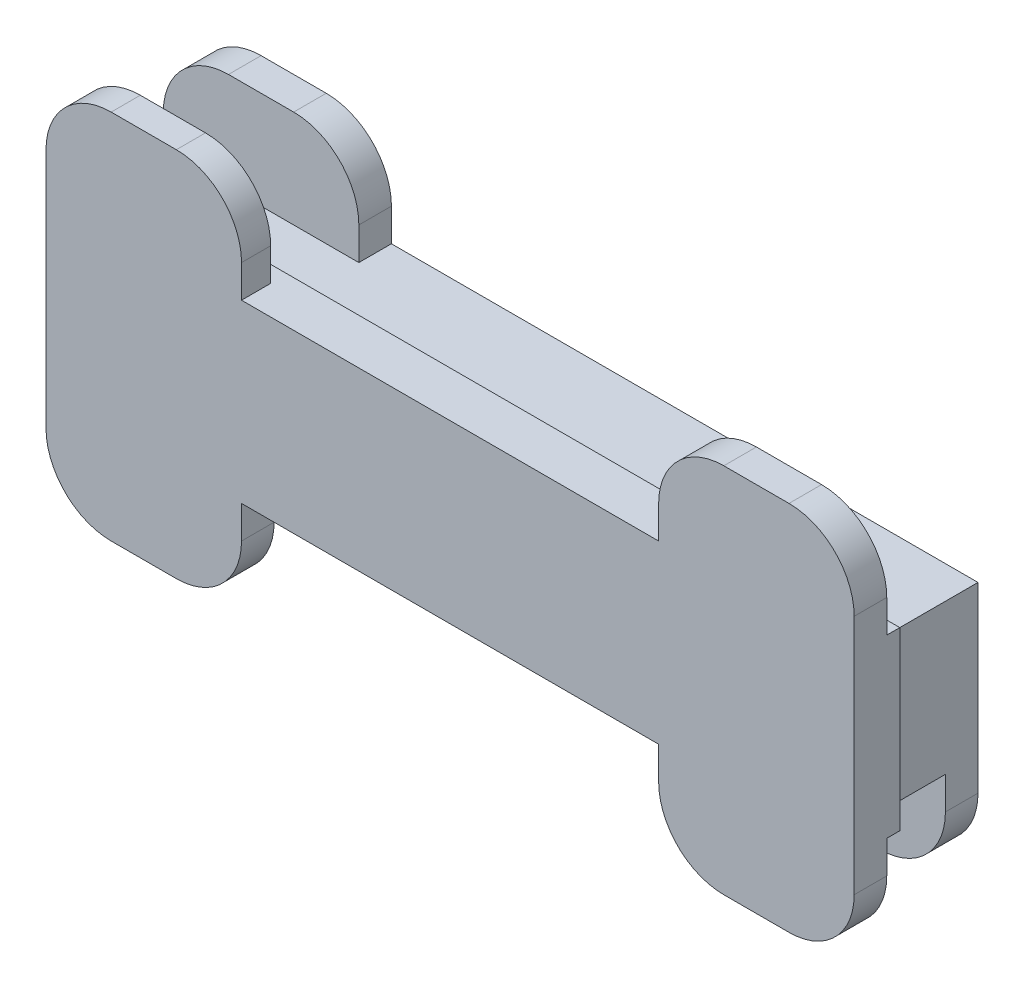
from build123d import *

# Parameters (mm, degrees)
EXTRUDE_1_OUTLINE_W         = 15
EXTRUDE_1_OUTLINE_H         = 15
EXTRUDE_1_DEPTH             = 8
SKETCH_2_W                  = 6
SKETCH_2_H                  = 11
CUT_EXTRUDE_1_DEPTH         = 13
SKETCH_3_W                  = 3
SKETCH_3_H                  = 15
EXTRUDE_2_DEPTH             = 2
PATTERN_LINEAR_2_COUNT      = 11
PATTERN_LINEAR_2_PITCH      = 10
SKETCH_5_W                  = 12
SKETCH_5_H                  = 15
EXTRUDE_3_DEPTH             = 2
SKETCH_6_W                  = 15
SKETCH_6_H                  = 15
EXTRUDE_4_DEPTH             = 2
SKETCH_7_W                  = 94
SKETCH_7_H                  = 2
CUT_EXTRUDE_2_DEPTH         = 2
SKETCH_9_W                  = 108
SKETCH_9_H                  = 13
SKETCH_9_W_2                = 106
SKETCH_9_H_2                = 11
EXTRUDE_5_DEPTH             = 2
SKETCH_10_W                 = 2
SKETCH_10_H                 = 2.5
EXTRUDE_6_DEPTH             = 2
PATTERN_LINEAR_3_COUNT      = 10
PATTERN_LINEAR_3_PITCH      = 10
SKETCH_11_W                 = 120
SKETCH_11_H                 = 23
EXTRUDE_7_DEPTH             = 21
SPLIT_START                 = 2
SPLIT_BODIES_2_DEPTH        = 11
SPLIT_START_2               = -4
SPLIT_BODIES_2_2_DEPTH      = 23
SPLIT_BODIES_2_3_OUTLINE_W  = 108
SPLIT_BODIES_2_3_OUTLINE_H  = 2
SPLIT_BODIES_2_3_DEPTH      = 5
SPLIT_START_3               = 14
SPLIT_BODIES_2_4_OUTLINE_W  = 108
SPLIT_BODIES_2_4_OUTLINE_H  = 2
SPLIT_BODIES_2_4_DEPTH      = 5
SPLIT_START_4               = 6.5
SPLIT_BODIES_2_5_DEPTH      = 2
SPLIT_START_5               = 5.5
SPLIT_BODIES_2_6_OUTLINE_W  = 2
SPLIT_BODIES_2_6_OUTLINE_H  = 2
SPLIT_BODIES_2_6_DEPTH      = 4
SPLIT_BODIES_2_7_OUTLINE_W  = 2
SPLIT_BODIES_2_7_OUTLINE_H  = 2
SPLIT_BODIES_2_7_DEPTH      = 1
SPLIT_START_6               = 12
SPLIT_BODIES_2_8_OUTLINE_W  = 2
SPLIT_BODIES_2_8_OUTLINE_H  = 2
SPLIT_BODIES_2_8_DEPTH      = 1
SPLIT_BODIES_2_9_OUTLINE_W  = 120
SPLIT_BODIES_2_9_OUTLINE_H  = 23
SPLIT_BODIES_2_9_DEPTH      = 6
SPLIT_START_7               = -13
SPLIT_BODIES_2_10_OUTLINE_W = 6
SPLIT_BODIES_2_10_OUTLINE_H = 11
SPLIT_BODIES_2_10_DEPTH     = 13
SPLIT_START_8               = -2
SPLIT_BODIES_2_11_OUTLINE_W = 4
SPLIT_BODIES_2_11_OUTLINE_H = 2
SPLIT_BODIES_2_11_DEPTH     = 2
SKETCH_12_W                 = 30
SKETCH_12_H                 = 5
EXTRUDE_8_DEPTH             = 15
SKETCH_13_W                 = 30
SKETCH_13_H                 = 5
EXTRUDE_9_DEPTH             = 15
FILLET_4_R                  = 10
FILLET_5_R                  = 10
FILLET_6_R                  = 10
FILLET_7_R                  = 10
SKETCH_14_W                 = 124
SKETCH_14_H                 = 27
SKETCH_14_W_2               = 120
SKETCH_14_H_2               = 23
EXTRUDE_10_DEPTH            = 7
SKETCH_16_W                 = 30
SKETCH_16_H                 = 5
EXTRUDE_12_DEPTH            = 15
SKETCH_18_W                 = 30
SKETCH_18_H                 = 4.472657844
SKETCH_18_H_2               = 5
EXTRUDE_13_DEPTH            = 15
FILLET_8_R                  = 10
FILLET_9_R                  = 10
FILLET_10_R                 = 10
FILLET_11_R                 = 10
FILLET_12_R                 = 10
FILLET_13_R                 = 10
FILLET_14_R                 = 10
FILLET_15_R                 = 10


# Read off the part's stored shape, not the designer's step: 凸台-拉伸1, 分割2
with BuildPart() as part:
    # 凸台-拉伸1 outline → 凸台-拉伸1 (new body)
    with BuildSketch(Plane.YZ):
        with Locations((7.5, -7.5)):
            Rectangle(EXTRUDE_1_OUTLINE_W, EXTRUDE_1_OUTLINE_H)
    extrude(amount=EXTRUDE_1_DEPTH)

    # 草图2 → 切除-拉伸1 (cut)
    with BuildSketch(Plane.XY):
        with Locations((4, 7.5)):
            Rectangle(SKETCH_2_W, SKETCH_2_H)
    extrude(amount=-CUT_EXTRUDE_1_DEPTH, mode=Mode.SUBTRACT)

    # 草图3 → 凸台-拉伸2 (add)
    with BuildSketch(Plane(origin=(8, 0, 0), x_dir=(0, 0, -1), z_dir=(1, 0, 0))):
        with Locations((1.5, 7.5)):
            Rectangle(SKETCH_3_W, SKETCH_3_H)
    extrude(amount=EXTRUDE_2_DEPTH)


with BuildPart() as pattern_linear_2_1:
    # 阵列(线性)2: pattern copy
    add(part.part.moved(Location(Vector(1, 0, 0) * (1 * PATTERN_LINEAR_2_PITCH))))


with BuildPart() as pattern_linear_2_2:
    # 阵列(线性)2: pattern copy
    add(part.part.moved(Location(Vector(1, 0, 0) * (2 * PATTERN_LINEAR_2_PITCH))))


with BuildPart() as pattern_linear_2_3:
    # 阵列(线性)2: pattern copy
    add(part.part.moved(Location(Vector(1, 0, 0) * (3 * PATTERN_LINEAR_2_PITCH))))


with BuildPart() as pattern_linear_2_4:
    # 阵列(线性)2: pattern copy
    add(part.part.moved(Location(Vector(1, 0, 0) * (4 * PATTERN_LINEAR_2_PITCH))))


with BuildPart() as pattern_linear_2_5:
    # 阵列(线性)2: pattern copy
    add(part.part.moved(Location(Vector(1, 0, 0) * (5 * PATTERN_LINEAR_2_PITCH))))


with BuildPart() as pattern_linear_2_6:
    # 阵列(线性)2: pattern copy
    add(part.part.moved(Location(Vector(1, 0, 0) * (6 * PATTERN_LINEAR_2_PITCH))))


with BuildPart() as pattern_linear_2_7:
    # 阵列(线性)2: pattern copy
    add(part.part.moved(Location(Vector(1, 0, 0) * (7 * PATTERN_LINEAR_2_PITCH))))


with BuildPart() as pattern_linear_2_8:
    # 阵列(线性)2: pattern copy
    add(part.part.moved(Location(Vector(1, 0, 0) * (8 * PATTERN_LINEAR_2_PITCH))))


with BuildPart() as pattern_linear_2_9:
    # 阵列(线性)2: pattern copy
    add(part.part.moved(Location(Vector(1, 0, 0) * (9 * PATTERN_LINEAR_2_PITCH))))


with BuildPart() as pattern_linear_2_10:
    # 阵列(线性)2: pattern copy
    add(part.part.moved(Location(Vector(1, 0, 0) * (10 * PATTERN_LINEAR_2_PITCH))))


with BuildPart() as part_1:
    add(part.part)

    # Combine 2: union 阵列(线性)2_1, 阵列(线性)2_2, 阵列(线性)2_3, 阵列(线性)2_4, 阵列(线性)2_5, 阵列(线性)2_6, 阵列(线性)2_7, 阵列(线性)2_8, 阵列(线性)2_9, 阵列(线性)2_10
    add(pattern_linear_2_1.part)
    add(pattern_linear_2_2.part)
    add(pattern_linear_2_3.part)
    add(pattern_linear_2_4.part)
    add(pattern_linear_2_5.part)
    add(pattern_linear_2_6.part)
    add(pattern_linear_2_7.part)
    add(pattern_linear_2_8.part)
    add(pattern_linear_2_9.part)
    add(pattern_linear_2_10.part)

    # 草图5 → 凸台-拉伸3 (add)
    with BuildSketch(Plane(origin=(108, 0, 0), x_dir=(0, 0, -1), z_dir=(1, 0, 0))):
        with Locations((9, 7.5)):
            Rectangle(SKETCH_5_W, SKETCH_5_H)
    extrude(amount=EXTRUDE_3_DEPTH)

    # 草图6 → 凸台-拉伸4 (add)
    with BuildSketch(Plane.ZY):
        with Locations((-7.5, 7.5)):
            Rectangle(SKETCH_6_W, SKETCH_6_H)
    extrude(amount=EXTRUDE_4_DEPTH)

    # 草图7 → 切除-拉伸2 (cut)
    with BuildSketch(Plane.XY):
        with Locations((54, 7.5)):
            Rectangle(SKETCH_7_W, SKETCH_7_H)
    extrude(amount=-CUT_EXTRUDE_2_DEPTH, mode=Mode.SUBTRACT)

    # 草图9 → 凸台-拉伸5 (add)
    with BuildSketch(Plane.XY):
        with Locations((54, 7.5)):
            Rectangle(SKETCH_9_W, SKETCH_9_H)
        with Locations((54, 7.5)):
            Rectangle(SKETCH_9_W_2, SKETCH_9_H_2, mode=Mode.SUBTRACT)
    extrude(amount=EXTRUDE_5_DEPTH)

    # 草图10 → 凸台-拉伸6 (add)
    with BuildSketch(Plane.XY):
        with Locations((9, 4.25)):
            Rectangle(SKETCH_10_W, SKETCH_10_H)
        with Locations((9, 10.75)):
            Rectangle(SKETCH_10_W, SKETCH_10_H)
    extrude_6 = extrude(amount=EXTRUDE_6_DEPTH)

    # 阵列(线性)3: 凸台-拉伸6 ×10
    with Locations(*[(i * PATTERN_LINEAR_3_PITCH, 0, 0) for i in range(1, PATTERN_LINEAR_3_COUNT)]):
        add(extrude_6)


with BuildPart() as body_2:
    # 草图11 → 凸台-拉伸7 (new body)
    with BuildSketch(Plane(origin=(0, 0, -15), x_dir=(-1, 0, 0), z_dir=(0, 0, -1))):
        with Locations((-54, 7.5)):
            Rectangle(SKETCH_11_W, SKETCH_11_H)
    extrude(amount=-EXTRUDE_7_DEPTH)

    # Combine 3: cut part
    add(part_1.part, mode=Mode.SUBTRACT)

    # Split Bodies 2 9 outline → Split Bodies 2 9 (cut)
    with BuildSketch(Plane.XY):
        with Locations((54, 7.5)):
            Rectangle(SPLIT_BODIES_2_9_OUTLINE_W, SPLIT_BODIES_2_9_OUTLINE_H)
    extrude(amount=SPLIT_BODIES_2_9_DEPTH, mode=Mode.SUBTRACT)

    # Split Bodies 2 10 outline → Split Bodies 2 10 (cut)
    with BuildSketch(Plane.XY.offset(SPLIT_START_7)):
        with Locations((4, 7.5)):
            Rectangle(SPLIT_BODIES_2_10_OUTLINE_W, SPLIT_BODIES_2_10_OUTLINE_H)
        with Locations((14, 7.5)):
            Rectangle(SPLIT_BODIES_2_10_OUTLINE_W, SPLIT_BODIES_2_10_OUTLINE_H)
        with Locations((24, 7.5)):
            Rectangle(SPLIT_BODIES_2_10_OUTLINE_W, SPLIT_BODIES_2_10_OUTLINE_H)
        with Locations((34, 7.5)):
            Rectangle(SPLIT_BODIES_2_10_OUTLINE_W, SPLIT_BODIES_2_10_OUTLINE_H)
        with Locations((44, 7.5)):
            Rectangle(SPLIT_BODIES_2_10_OUTLINE_W, SPLIT_BODIES_2_10_OUTLINE_H)
        with Locations((54, 7.5)):
            Rectangle(SPLIT_BODIES_2_10_OUTLINE_W, SPLIT_BODIES_2_10_OUTLINE_H)
        with Locations((64, 7.5)):
            Rectangle(SPLIT_BODIES_2_10_OUTLINE_W, SPLIT_BODIES_2_10_OUTLINE_H)
        with Locations((74, 7.5)):
            Rectangle(SPLIT_BODIES_2_10_OUTLINE_W, SPLIT_BODIES_2_10_OUTLINE_H)
        with Locations((84, 7.5)):
            Rectangle(SPLIT_BODIES_2_10_OUTLINE_W, SPLIT_BODIES_2_10_OUTLINE_H)
        with Locations((94, 7.5)):
            Rectangle(SPLIT_BODIES_2_10_OUTLINE_W, SPLIT_BODIES_2_10_OUTLINE_H)
        with Locations((104, 7.5)):
            Rectangle(SPLIT_BODIES_2_10_OUTLINE_W, SPLIT_BODIES_2_10_OUTLINE_H)
    extrude(amount=SPLIT_BODIES_2_10_DEPTH, mode=Mode.SUBTRACT)

    # Split Bodies 2 11 outline → Split Bodies 2 11 (cut)
    with BuildSketch(Plane.XY.offset(SPLIT_START_8)):
        with Locations((9, 7.5)):
            Rectangle(SPLIT_BODIES_2_11_OUTLINE_W, SPLIT_BODIES_2_11_OUTLINE_H)
        with Locations((19, 7.5)):
            Rectangle(SPLIT_BODIES_2_11_OUTLINE_W, SPLIT_BODIES_2_11_OUTLINE_H)
        with Locations((29, 7.5)):
            Rectangle(SPLIT_BODIES_2_11_OUTLINE_W, SPLIT_BODIES_2_11_OUTLINE_H)
        with Locations((39, 7.5)):
            Rectangle(SPLIT_BODIES_2_11_OUTLINE_W, SPLIT_BODIES_2_11_OUTLINE_H)
        with Locations((49, 7.5)):
            Rectangle(SPLIT_BODIES_2_11_OUTLINE_W, SPLIT_BODIES_2_11_OUTLINE_H)
        with Locations((59, 7.5)):
            Rectangle(SPLIT_BODIES_2_11_OUTLINE_W, SPLIT_BODIES_2_11_OUTLINE_H)
        with Locations((69, 7.5)):
            Rectangle(SPLIT_BODIES_2_11_OUTLINE_W, SPLIT_BODIES_2_11_OUTLINE_H)
        with Locations((79, 7.5)):
            Rectangle(SPLIT_BODIES_2_11_OUTLINE_W, SPLIT_BODIES_2_11_OUTLINE_H)
        with Locations((89, 7.5)):
            Rectangle(SPLIT_BODIES_2_11_OUTLINE_W, SPLIT_BODIES_2_11_OUTLINE_H)
        with Locations((99, 7.5)):
            Rectangle(SPLIT_BODIES_2_11_OUTLINE_W, SPLIT_BODIES_2_11_OUTLINE_H)
    extrude(amount=SPLIT_BODIES_2_11_DEPTH, mode=Mode.SUBTRACT)

    # 草图12 → 凸台-拉伸8 (add)
    with BuildSketch(Plane(origin=(0, 19, 0), x_dir=(1, 0, 0), z_dir=(0, 1, 0))):
        with Locations((9, 12.5)):
            Rectangle(SKETCH_12_W, SKETCH_12_H)
    extrude(amount=EXTRUDE_8_DEPTH)

    # 草图13 → 凸台-拉伸9 (add)
    with BuildSketch(Plane.XZ.offset(4)):
        with Locations((99, -12.5)):
            Rectangle(SKETCH_13_W, SKETCH_13_H)
    extrude(amount=EXTRUDE_9_DEPTH)

    # 圆角4
    fillet_4_edges = [body_2.edges().sort_by_distance(p)[0] for p in [
        (84, -19, -12.5),
    ]]
    fillet(fillet_4_edges, radius=FILLET_4_R)

    # 圆角5
    fillet_5_edges = [body_2.edges().sort_by_distance(p)[0] for p in [
        (114, -19, -12.5),
    ]]
    fillet(fillet_5_edges, radius=FILLET_5_R)

    # 圆角6
    fillet_6_edges = [body_2.edges().sort_by_distance(p)[0] for p in [
        (-6, 34, -12.5),
    ]]
    fillet(fillet_6_edges, radius=FILLET_6_R)

    # 圆角7
    fillet_7_edges = [body_2.edges().sort_by_distance(p)[0] for p in [
        (24, 34, -12.5),
    ]]
    fillet(fillet_7_edges, radius=FILLET_7_R)


with BuildPart() as body_2_2:
    # Split Bodies 2 outline → Split Bodies 2 (new body)
    with BuildSketch(Plane(origin=(0, 0, 0), x_dir=(1, 0, 0), z_dir=(0, 1, 0)).offset(SPLIT_START)):
        Polygon((97, 0), (97, 13), (91, 13), (91, 0), (90, 0), (90, -2), (88, -2), (88, 0), (87, 0), (87, 13), (81, 13), (81, 0), (80, 0), (80, -2), (78, -2), (78, 0), (77, 0), (77, 13), (71, 13), (71, 0), (70, 0), (70, -2), (68, -2), (68, 0), (67, 0), (67, 13), (61, 13), (61, 0), (60, 0), (60, -2), (58, -2), (58, 0), (57, 0), (57, 13), (51, 13), (51, 0), (50, 0), (50, -2), (48, -2), (48, 0), (47, 0), (47, 13), (41, 13), (41, 0), (40, 0), (40, -2), (38, -2), (38, 0), (37, 0), (37, 13), (31, 13), (31, 0), (30, 0), (30, -2), (28, -2), (28, 0), (27, 0), (27, 13), (21, 13), (21, 0), (20, 0), (20, -2), (18, -2), (18, 0), (17, 0), (17, 13), (11, 13), (11, 0), (10, 0), (10, -2), (8, -2), (8, 0), (7, 0), (7, 13), (1, 13), (1, -2), (0, -2), (0, 0), (-6, 0), (-6, -6), (114, -6), (114, 0), (108, 0), (108, -2), (107, -2), (107, 13), (101, 13), (101, 0), (100, 0), (100, -2), (98, -2), (98, 0), align=None)
    extrude(amount=SPLIT_BODIES_2_DEPTH)

    # Split Bodies 2 2 outline → Split Bodies 2 2 (add)
    with BuildSketch(Plane(origin=(0, 0, 0), x_dir=(1, 0, 0), z_dir=(0, 1, 0)).offset(SPLIT_START_2)):
        Polygon((108, -2), (0, -2), (0, 0), (-6, 0), (-6, -6), (114, -6), (114, 0), (108, 0), align=None)
    extrude(amount=SPLIT_BODIES_2_2_DEPTH)

    # Split Bodies 2 3 outline → Split Bodies 2 3 (add)
    with BuildSketch(Plane(origin=(0, 0, 0), x_dir=(1, 0, 0), z_dir=(0, 1, 0)).offset(SPLIT_START_2)):
        with Locations((54, -1)):
            Rectangle(SPLIT_BODIES_2_3_OUTLINE_W, SPLIT_BODIES_2_3_OUTLINE_H)
    extrude(amount=SPLIT_BODIES_2_3_DEPTH)

    # Split Bodies 2 4 outline → Split Bodies 2 4 (add)
    with BuildSketch(Plane(origin=(0, 0, 0), x_dir=(1, 0, 0), z_dir=(0, 1, 0)).offset(SPLIT_START_3)):
        with Locations((54, -1)):
            Rectangle(SPLIT_BODIES_2_4_OUTLINE_W, SPLIT_BODIES_2_4_OUTLINE_H)
    extrude(amount=SPLIT_BODIES_2_4_DEPTH)

    # Split Bodies 2 5 outline → Split Bodies 2 5 (add)
    with BuildSketch(Plane(origin=(0, 0, 0), x_dir=(1, 0, 0), z_dir=(0, 1, 0)).offset(SPLIT_START_4)):
        Polygon((101, 2), (97, 2), (97, 0), (98, 0), (98, -2), (100, -2), (100, 0), (101, 0), align=None)
        Polygon((90, 0), (91, 0), (91, 2), (87, 2), (87, 0), (88, 0), (88, -2), (90, -2), align=None)
        Polygon((80, 0), (81, 0), (81, 2), (77, 2), (77, 0), (78, 0), (78, -2), (80, -2), align=None)
        Polygon((68, -2), (70, -2), (70, 0), (71, 0), (71, 2), (67, 2), (67, 0), (68, 0), align=None)
        Polygon((58, -2), (60, -2), (60, 0), (61, 0), (61, 2), (57, 2), (57, 0), (58, 0), align=None)
        Polygon((7, 2), (7, 0), (8, 0), (8, -2), (10, -2), (10, 0), (11, 0), (11, 2), align=None)
        Polygon((48, -2), (50, -2), (50, 0), (51, 0), (51, 2), (47, 2), (47, 0), (48, 0), align=None)
        Polygon((18, 0), (18, -2), (20, -2), (20, 0), (21, 0), (21, 2), (17, 2), (17, 0), align=None)
        Polygon((38, -2), (40, -2), (40, 0), (41, 0), (41, 2), (37, 2), (37, 0), (38, 0), align=None)
        Polygon((28, 0), (28, -2), (30, -2), (30, 0), (31, 0), (31, 2), (27, 2), (27, 0), align=None)
    extrude(amount=SPLIT_BODIES_2_5_DEPTH)

    # Split Bodies 2 6 outline → Split Bodies 2 6 (add)
    with BuildSketch(Plane(origin=(0, 0, 0), x_dir=(1, 0, 0), z_dir=(0, 1, 0)).offset(SPLIT_START_5)):
        with Locations((99, -1)):
            Rectangle(SPLIT_BODIES_2_6_OUTLINE_W, SPLIT_BODIES_2_6_OUTLINE_H)
        with Locations((89, -1)):
            Rectangle(SPLIT_BODIES_2_6_OUTLINE_W, SPLIT_BODIES_2_6_OUTLINE_H)
        with Locations((79, -1)):
            Rectangle(SPLIT_BODIES_2_6_OUTLINE_W, SPLIT_BODIES_2_6_OUTLINE_H)
        with Locations((69, -1)):
            Rectangle(SPLIT_BODIES_2_6_OUTLINE_W, SPLIT_BODIES_2_6_OUTLINE_H)
        with Locations((59, -1)):
            Rectangle(SPLIT_BODIES_2_6_OUTLINE_W, SPLIT_BODIES_2_6_OUTLINE_H)
        with Locations((9, -1)):
            Rectangle(SPLIT_BODIES_2_6_OUTLINE_W, SPLIT_BODIES_2_6_OUTLINE_H)
        with Locations((49, -1)):
            Rectangle(SPLIT_BODIES_2_6_OUTLINE_W, SPLIT_BODIES_2_6_OUTLINE_H)
        with Locations((19, -1)):
            Rectangle(SPLIT_BODIES_2_6_OUTLINE_W, SPLIT_BODIES_2_6_OUTLINE_H)
        with Locations((39, -1)):
            Rectangle(SPLIT_BODIES_2_6_OUTLINE_W, SPLIT_BODIES_2_6_OUTLINE_H)
        with Locations((29, -1)):
            Rectangle(SPLIT_BODIES_2_6_OUTLINE_W, SPLIT_BODIES_2_6_OUTLINE_H)
    extrude(amount=SPLIT_BODIES_2_6_DEPTH)

    # Split Bodies 2 7 outline → Split Bodies 2 7 (add)
    with BuildSketch(Plane(origin=(0, 0, 0), x_dir=(1, 0, 0), z_dir=(0, 1, 0)).offset(SPLIT_START)):
        with Locations((99, -1)):
            Rectangle(SPLIT_BODIES_2_7_OUTLINE_W, SPLIT_BODIES_2_7_OUTLINE_H)
        with Locations((89, -1)):
            Rectangle(SPLIT_BODIES_2_7_OUTLINE_W, SPLIT_BODIES_2_7_OUTLINE_H)
        with Locations((79, -1)):
            Rectangle(SPLIT_BODIES_2_7_OUTLINE_W, SPLIT_BODIES_2_7_OUTLINE_H)
        with Locations((69, -1)):
            Rectangle(SPLIT_BODIES_2_7_OUTLINE_W, SPLIT_BODIES_2_7_OUTLINE_H)
        with Locations((59, -1)):
            Rectangle(SPLIT_BODIES_2_7_OUTLINE_W, SPLIT_BODIES_2_7_OUTLINE_H)
        with Locations((9, -1)):
            Rectangle(SPLIT_BODIES_2_7_OUTLINE_W, SPLIT_BODIES_2_7_OUTLINE_H)
        with Locations((49, -1)):
            Rectangle(SPLIT_BODIES_2_7_OUTLINE_W, SPLIT_BODIES_2_7_OUTLINE_H)
        with Locations((19, -1)):
            Rectangle(SPLIT_BODIES_2_7_OUTLINE_W, SPLIT_BODIES_2_7_OUTLINE_H)
        with Locations((39, -1)):
            Rectangle(SPLIT_BODIES_2_7_OUTLINE_W, SPLIT_BODIES_2_7_OUTLINE_H)
        with Locations((29, -1)):
            Rectangle(SPLIT_BODIES_2_7_OUTLINE_W, SPLIT_BODIES_2_7_OUTLINE_H)
    extrude(amount=SPLIT_BODIES_2_7_DEPTH)

    # Split Bodies 2 8 outline → Split Bodies 2 8 (add)
    with BuildSketch(Plane(origin=(0, 0, 0), x_dir=(1, 0, 0), z_dir=(0, 1, 0)).offset(SPLIT_START_6)):
        with Locations((99, -1)):
            Rectangle(SPLIT_BODIES_2_8_OUTLINE_W, SPLIT_BODIES_2_8_OUTLINE_H)
        with Locations((89, -1)):
            Rectangle(SPLIT_BODIES_2_8_OUTLINE_W, SPLIT_BODIES_2_8_OUTLINE_H)
        with Locations((79, -1)):
            Rectangle(SPLIT_BODIES_2_8_OUTLINE_W, SPLIT_BODIES_2_8_OUTLINE_H)
        with Locations((69, -1)):
            Rectangle(SPLIT_BODIES_2_8_OUTLINE_W, SPLIT_BODIES_2_8_OUTLINE_H)
        with Locations((59, -1)):
            Rectangle(SPLIT_BODIES_2_8_OUTLINE_W, SPLIT_BODIES_2_8_OUTLINE_H)
        with Locations((9, -1)):
            Rectangle(SPLIT_BODIES_2_8_OUTLINE_W, SPLIT_BODIES_2_8_OUTLINE_H)
        with Locations((49, -1)):
            Rectangle(SPLIT_BODIES_2_8_OUTLINE_W, SPLIT_BODIES_2_8_OUTLINE_H)
        with Locations((19, -1)):
            Rectangle(SPLIT_BODIES_2_8_OUTLINE_W, SPLIT_BODIES_2_8_OUTLINE_H)
        with Locations((39, -1)):
            Rectangle(SPLIT_BODIES_2_8_OUTLINE_W, SPLIT_BODIES_2_8_OUTLINE_H)
        with Locations((29, -1)):
            Rectangle(SPLIT_BODIES_2_8_OUTLINE_W, SPLIT_BODIES_2_8_OUTLINE_H)
    extrude(amount=SPLIT_BODIES_2_8_DEPTH)

    # 草图14 → 凸台-拉伸10 (add)
    with BuildSketch(Plane.XY.offset(6)):
        with Locations((54, 7.5)):
            Rectangle(SKETCH_14_W, SKETCH_14_H)
        with Locations((54, 7.5)):
            Rectangle(SKETCH_14_W_2, SKETCH_14_H_2, mode=Mode.SUBTRACT)
    extrude(amount=-EXTRUDE_10_DEPTH)

    # 草图16 → 凸台-拉伸12 (add)
    with BuildSketch(Plane.XZ.offset(6)):
        with Locations((101, 3.5)):
            Rectangle(SKETCH_16_W, SKETCH_16_H)
        with Locations((7, 3.5)):
            Rectangle(SKETCH_16_W, SKETCH_16_H)
    extrude(amount=EXTRUDE_12_DEPTH)

    # 草图18 → 凸台-拉伸13 (add)
    with BuildSketch(Plane(origin=(0, 21, 0), x_dir=(1, 0, 0), z_dir=(0, 1, 0))):
        with Locations((7, -3.763671078)):
            Rectangle(SKETCH_18_W, SKETCH_18_H)
        with Locations((101, -3.5)):
            Rectangle(SKETCH_18_W, SKETCH_18_H_2)
    extrude(amount=EXTRUDE_13_DEPTH)

    # 圆角8
    fillet_8_edges = [body_2_2.edges().sort_by_distance(p)[0] for p in [
        (-8, 36, 3.763671078),
    ]]
    fillet(fillet_8_edges, radius=FILLET_8_R)

    # 圆角9
    fillet_9_edges = [body_2_2.edges().sort_by_distance(p)[0] for p in [
        (22, 36, 3.763671078),
    ]]
    fillet(fillet_9_edges, radius=FILLET_9_R)

    # 圆角10
    fillet_10_edges = [body_2_2.edges().sort_by_distance(p)[0] for p in [
        (116, 36, 3.5),
    ]]
    fillet(fillet_10_edges, radius=FILLET_10_R)

    # 圆角11
    fillet_11_edges = [body_2_2.edges().sort_by_distance(p)[0] for p in [
        (86, 36, 3.5),
    ]]
    fillet(fillet_11_edges, radius=FILLET_11_R)

    # 圆角12
    fillet_12_edges = [body_2_2.edges().sort_by_distance(p)[0] for p in [
        (86, -21, 3.5),
    ]]
    fillet(fillet_12_edges, radius=FILLET_12_R)

    # 圆角13
    fillet_13_edges = [body_2_2.edges().sort_by_distance(p)[0] for p in [
        (116, -21, 3.5),
    ]]
    fillet(fillet_13_edges, radius=FILLET_13_R)

    # 圆角14
    fillet_14_edges = [body_2_2.edges().sort_by_distance(p)[0] for p in [
        (-8, -21, 3.5),
    ]]
    fillet(fillet_14_edges, radius=FILLET_14_R)

    # 圆角15
    fillet_15_edges = [body_2_2.edges().sort_by_distance(p)[0] for p in [
        (22, -21, 3.5),
    ]]
    fillet(fillet_15_edges, radius=FILLET_15_R)


solid = Compound([body_2.part, body_2_2.part])
